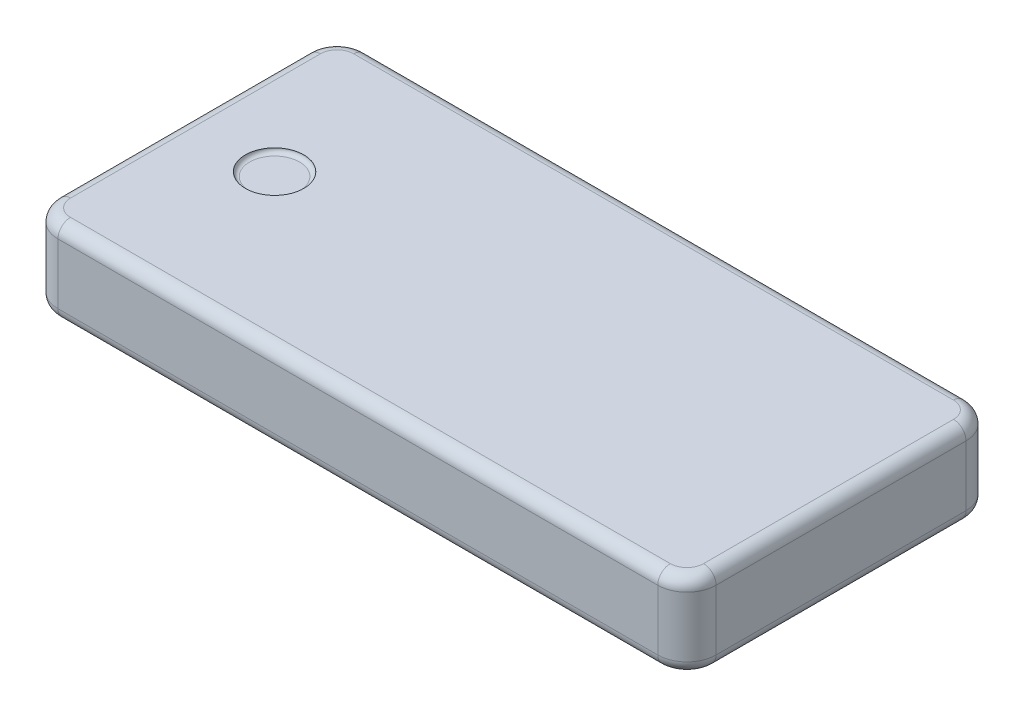
from build123d import *

# Parameters (mm, degrees)
BOSS_EXTRUDE1_DEPTH = 20.5
FILLET1_R           = 3
SKETCH2_R           = 7
CUT_EXTRUDE1_DEPTH  = 1
FILLET2_R           = 1


with BuildPart() as part:
    # Sketch1 → Boss-Extrude1 (new body)
    with BuildSketch(Plane(origin=(0, 0, 0), x_dir=(1, 0, 0), z_dir=(0, 1, 0))):
        with BuildLine():
            Line((7, 0), (151, 0))
            ThreePointArc((151, 0), (155.949747468, 2.050252532), (158, 7))
            Line((158, 7), (158, 67))
            ThreePointArc((158, 67), (155.949747468, 71.949747468), (151, 74))
            Line((151, 74), (7, 74))
            ThreePointArc((7, 74), (2.050252532, 71.949747468), (0, 67))
            Line((0, 67), (0, 7))
            ThreePointArc((0, 7), (2.050252532, 2.050252532), (7, 0))
        make_face()
    extrude(amount=BOSS_EXTRUDE1_DEPTH)

    # Fillet1
    fillet1_edges = [part.edges().sort_by_distance(p)[0] for p in [
        (0, 0, -37),
        (2.050252532, 0, -71.949747468),
        (79, 0, -74),
        (155.949747468, 0, -71.949747468),
        (2.050252532, 20.5, -71.949747468),
        (0, 20.5, -37),
        (2.050252532, 20.5, -2.050252532),
        (79, 20.5, 0),
        (155.949747468, 20.5, -2.050252532),
        (158, 20.5, -37),
        (155.949747468, 20.5, -71.949747468),
        (158, 0, -37),
        (79, 20.5, -74),
        (155.949747468, 0, -2.050252532),
        (79, 0, 0),
        (2.050252532, 0, -2.050252532),
    ]]
    fillet(fillet1_edges, radius=FILLET1_R)

    # Sketch2 → Cut-Extrude1 (cut)
    with BuildSketch(Plane(origin=(0, 20.5, 0), x_dir=(1, 0, 0), z_dir=(0, 1, 0))):
        with Locations(Location((22, 37, 0), (0, 0, 270))):
            Circle(SKETCH2_R)
    extrude(amount=-CUT_EXTRUDE1_DEPTH, mode=Mode.SUBTRACT)

    # Fillet2
    fillet2_edges = [part.edges().sort_by_distance(p)[0] for p in [
        (22, 19.5, -44),
    ]]
    fillet(fillet2_edges, radius=FILLET2_R - 0.0001)  # a hair under: the kernel refuses the full size


solid = part.part
